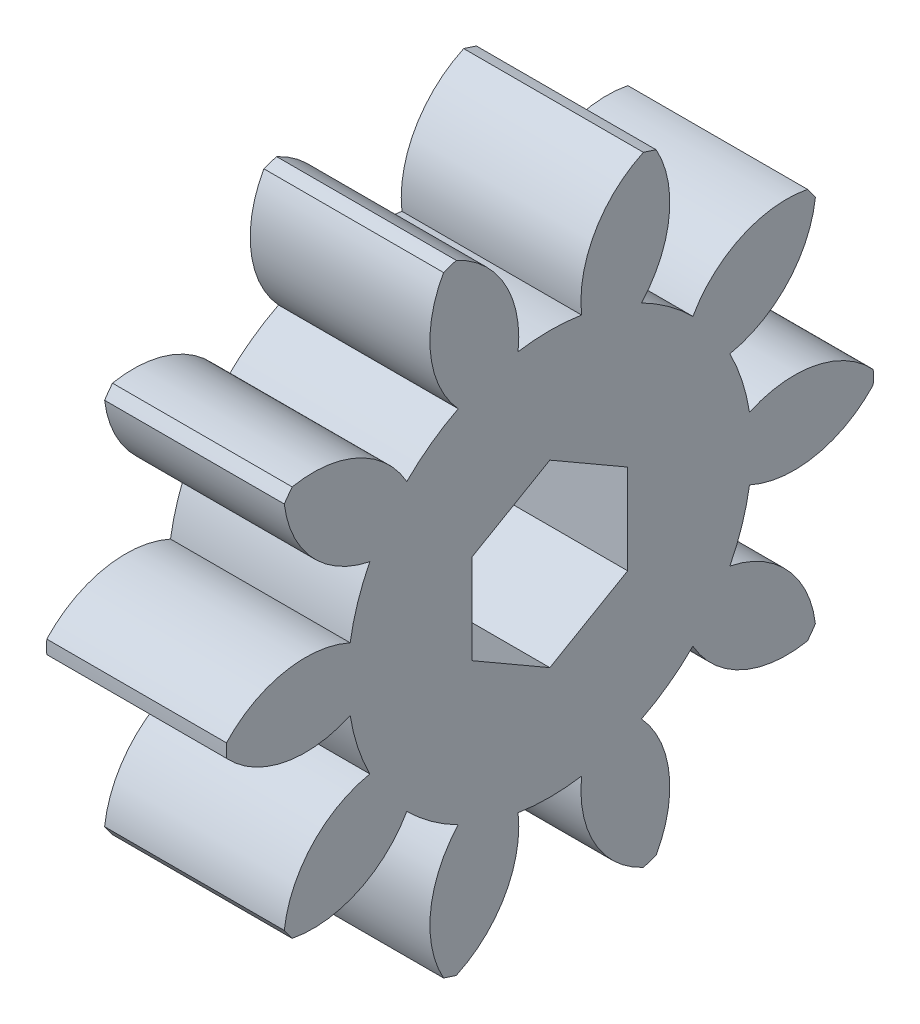
from build123d import *

# Parameters (mm, degrees)
BASPROSKE_W     = 5
BASPROSKE_H     = 9
TOOTHCUT_DEPTH  = 14.674794331
TEETHCUTS_COUNT = 10
TEETHCUTS_ANGLE = 324
BORE_DEPTH      = 50.0002032


with BuildPart() as part:
    # BasProSke → Base-Revolve (revolve)
    with BuildSketch(Plane(origin=(0, 0, 0), x_dir=(1, 0, 0), z_dir=(0, 1, 0))):
        with Locations((2.5, 4.5)):
            Rectangle(BASPROSKE_W, BASPROSKE_H)
    revolve(axis=Axis((-10, 0, 0), (1, 0, 0)))

    # TooCutSke → ToothCut (cut, through all)
    with BuildSketch(Plane(origin=(0, 0, 0), x_dir=(0, 0, -1), z_dir=(1, 0, 0))):
        with BuildLine():
            ThreePointArc((0.883878355, 5.554109745), (0, 5.624), (-0.883878355, 5.554109745))
            ThreePointArc((-0.883878355, 5.554109745), (-1.258245767, 7.379188248), (-2.637816971, 8.631324741))
            ThreePointArc((-2.637816971, 8.631324741), (0, 9.0254), (2.637816971, 8.631324741))
            ThreePointArc((2.637816971, 8.631324741), (1.258245767, 7.379188248), (0.883878355, 5.554109745))
        make_face()
    toothcut = extrude(amount=TOOTHCUT_DEPTH, mode=Mode.SUBTRACT)

    # TeethCuts: ToothCut ×10 about axis
    teethcuts_axis = Axis((-10, 0, 0), (1, 0, 0))
    for i in range(1, TEETHCUTS_COUNT):
        add(toothcut.rotate(teethcuts_axis, i * TEETHCUTS_ANGLE / (TEETHCUTS_COUNT - 1)), mode=Mode.SUBTRACT)

    # BorSke → Bore (cut, symmetric)
    with BuildSketch(Plane(origin=(0, 0, 0), x_dir=(0, 0, -1), z_dir=(1, 0, 0))):
        Polygon((0, 2.5), (-2.165063509, 1.25), (-2.165063509, -1.25), (0, -2.5), (2.165063509, -1.25), (2.165063509, 1.25), align=None)
    extrude(amount=BORE_DEPTH, both=True, mode=Mode.SUBTRACT)


solid = part.part
